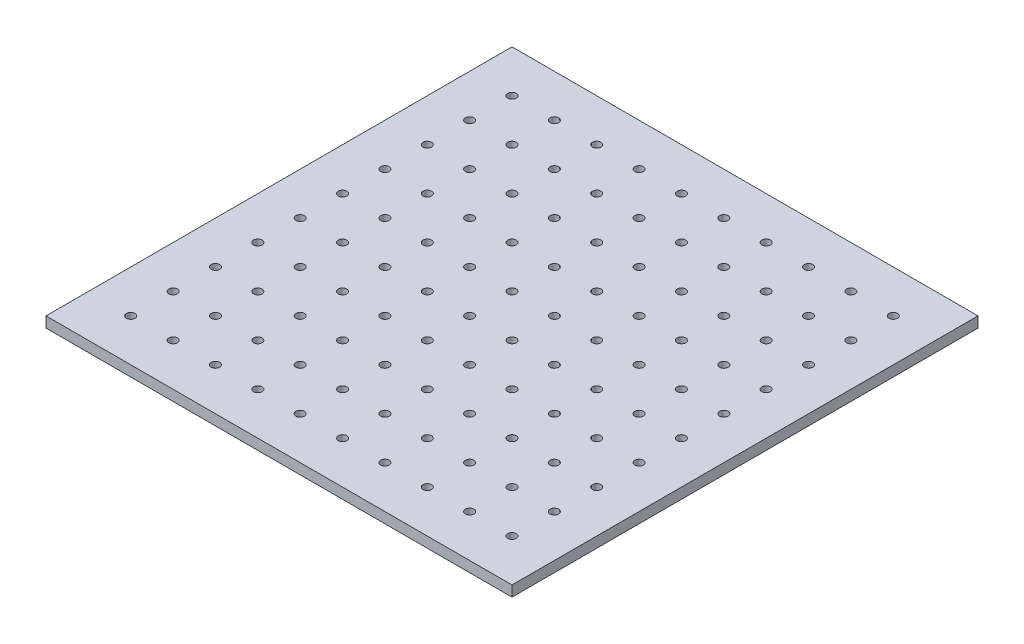
from build123d import *

# Parameters (mm, degrees)
SKETCH1_W           = 279.4
SKETCH1_H           = 279.4
SKETCH1_R           = 2.5527
BOSS_EXTRUDE1_DEPTH = 6.35


with BuildPart() as part:
    # Sketch1 → Boss-Extrude1 (new body)
    with BuildSketch(Plane(origin=(0, 0, 0), x_dir=(1, 0, 0), z_dir=(0, 1, 0))):
        with Locations((114.3, 114.3)):
            Rectangle(SKETCH1_W, SKETCH1_H)
        Circle(SKETCH1_R, mode=Mode.SUBTRACT)
        with Locations((25.4, 0)):
            Circle(SKETCH1_R, mode=Mode.SUBTRACT)
        with Locations((50.8, 0)):
            Circle(SKETCH1_R, mode=Mode.SUBTRACT)
        with Locations((76.2, 0)):
            Circle(SKETCH1_R, mode=Mode.SUBTRACT)
        with Locations((101.6, 0)):
            Circle(SKETCH1_R, mode=Mode.SUBTRACT)
        with Locations((127, 0)):
            Circle(SKETCH1_R, mode=Mode.SUBTRACT)
        with Locations((152.4, 0)):
            Circle(SKETCH1_R, mode=Mode.SUBTRACT)
        with Locations((177.8, 0)):
            Circle(SKETCH1_R, mode=Mode.SUBTRACT)
        with Locations((203.2, 0)):
            Circle(SKETCH1_R, mode=Mode.SUBTRACT)
        with Locations((228.6, 0)):
            Circle(SKETCH1_R, mode=Mode.SUBTRACT)
        with Locations((0, 25.4)):
            Circle(SKETCH1_R, mode=Mode.SUBTRACT)
        with Locations((25.4, 25.4)):
            Circle(SKETCH1_R, mode=Mode.SUBTRACT)
        with Locations((50.8, 25.4)):
            Circle(SKETCH1_R, mode=Mode.SUBTRACT)
        with Locations((76.2, 25.4)):
            Circle(SKETCH1_R, mode=Mode.SUBTRACT)
        with Locations((101.6, 25.4)):
            Circle(SKETCH1_R, mode=Mode.SUBTRACT)
        with Locations((127, 25.4)):
            Circle(SKETCH1_R, mode=Mode.SUBTRACT)
        with Locations((152.4, 25.4)):
            Circle(SKETCH1_R, mode=Mode.SUBTRACT)
        with Locations((177.8, 25.4)):
            Circle(SKETCH1_R, mode=Mode.SUBTRACT)
        with Locations((203.2, 25.4)):
            Circle(SKETCH1_R, mode=Mode.SUBTRACT)
        with Locations((228.6, 25.4)):
            Circle(SKETCH1_R, mode=Mode.SUBTRACT)
        with Locations((0, 50.8)):
            Circle(SKETCH1_R, mode=Mode.SUBTRACT)
        with Locations((25.4, 50.8)):
            Circle(SKETCH1_R, mode=Mode.SUBTRACT)
        with Locations((50.8, 50.8)):
            Circle(SKETCH1_R, mode=Mode.SUBTRACT)
        with Locations((76.2, 50.8)):
            Circle(SKETCH1_R, mode=Mode.SUBTRACT)
        with Locations((101.6, 50.8)):
            Circle(SKETCH1_R, mode=Mode.SUBTRACT)
        with Locations((127, 50.8)):
            Circle(SKETCH1_R, mode=Mode.SUBTRACT)
        with Locations((152.4, 50.8)):
            Circle(SKETCH1_R, mode=Mode.SUBTRACT)
        with Locations((177.8, 50.8)):
            Circle(SKETCH1_R, mode=Mode.SUBTRACT)
        with Locations((203.2, 50.8)):
            Circle(SKETCH1_R, mode=Mode.SUBTRACT)
        with Locations((228.6, 50.8)):
            Circle(SKETCH1_R, mode=Mode.SUBTRACT)
        with Locations((0, 76.2)):
            Circle(SKETCH1_R, mode=Mode.SUBTRACT)
        with Locations((25.4, 76.2)):
            Circle(SKETCH1_R, mode=Mode.SUBTRACT)
        with Locations((50.8, 76.2)):
            Circle(SKETCH1_R, mode=Mode.SUBTRACT)
        with Locations((76.2, 76.2)):
            Circle(SKETCH1_R, mode=Mode.SUBTRACT)
        with Locations((101.6, 76.2)):
            Circle(SKETCH1_R, mode=Mode.SUBTRACT)
        with Locations((127, 76.2)):
            Circle(SKETCH1_R, mode=Mode.SUBTRACT)
        with Locations((152.4, 76.2)):
            Circle(SKETCH1_R, mode=Mode.SUBTRACT)
        with Locations((177.8, 76.2)):
            Circle(SKETCH1_R, mode=Mode.SUBTRACT)
        with Locations((203.2, 76.2)):
            Circle(SKETCH1_R, mode=Mode.SUBTRACT)
        with Locations((228.6, 76.2)):
            Circle(SKETCH1_R, mode=Mode.SUBTRACT)
        with Locations((0, 101.6)):
            Circle(SKETCH1_R, mode=Mode.SUBTRACT)
        with Locations((25.4, 101.6)):
            Circle(SKETCH1_R, mode=Mode.SUBTRACT)
        with Locations((50.8, 101.6)):
            Circle(SKETCH1_R, mode=Mode.SUBTRACT)
        with Locations((76.2, 101.6)):
            Circle(SKETCH1_R, mode=Mode.SUBTRACT)
        with Locations((101.6, 101.6)):
            Circle(SKETCH1_R, mode=Mode.SUBTRACT)
        with Locations((127, 101.6)):
            Circle(SKETCH1_R, mode=Mode.SUBTRACT)
        with Locations((152.4, 101.6)):
            Circle(SKETCH1_R, mode=Mode.SUBTRACT)
        with Locations((177.8, 101.6)):
            Circle(SKETCH1_R, mode=Mode.SUBTRACT)
        with Locations((203.2, 101.6)):
            Circle(SKETCH1_R, mode=Mode.SUBTRACT)
        with Locations((228.6, 101.6)):
            Circle(SKETCH1_R, mode=Mode.SUBTRACT)
        with Locations((0, 127)):
            Circle(SKETCH1_R, mode=Mode.SUBTRACT)
        with Locations((25.4, 127)):
            Circle(SKETCH1_R, mode=Mode.SUBTRACT)
        with Locations((50.8, 127)):
            Circle(SKETCH1_R, mode=Mode.SUBTRACT)
        with Locations((76.2, 127)):
            Circle(SKETCH1_R, mode=Mode.SUBTRACT)
        with Locations((101.6, 127)):
            Circle(SKETCH1_R, mode=Mode.SUBTRACT)
        with Locations((127, 127)):
            Circle(SKETCH1_R, mode=Mode.SUBTRACT)
        with Locations((152.4, 127)):
            Circle(SKETCH1_R, mode=Mode.SUBTRACT)
        with Locations((177.8, 127)):
            Circle(SKETCH1_R, mode=Mode.SUBTRACT)
        with Locations((203.2, 127)):
            Circle(SKETCH1_R, mode=Mode.SUBTRACT)
        with Locations((228.6, 127)):
            Circle(SKETCH1_R, mode=Mode.SUBTRACT)
        with Locations((0, 152.4)):
            Circle(SKETCH1_R, mode=Mode.SUBTRACT)
        with Locations((25.4, 152.4)):
            Circle(SKETCH1_R, mode=Mode.SUBTRACT)
        with Locations((50.8, 152.4)):
            Circle(SKETCH1_R, mode=Mode.SUBTRACT)
        with Locations((76.2, 152.4)):
            Circle(SKETCH1_R, mode=Mode.SUBTRACT)
        with Locations((101.6, 152.4)):
            Circle(SKETCH1_R, mode=Mode.SUBTRACT)
        with Locations((127, 152.4)):
            Circle(SKETCH1_R, mode=Mode.SUBTRACT)
        with Locations((152.4, 152.4)):
            Circle(SKETCH1_R, mode=Mode.SUBTRACT)
        with Locations((177.8, 152.4)):
            Circle(SKETCH1_R, mode=Mode.SUBTRACT)
        with Locations((203.2, 152.4)):
            Circle(SKETCH1_R, mode=Mode.SUBTRACT)
        with Locations((228.6, 152.4)):
            Circle(SKETCH1_R, mode=Mode.SUBTRACT)
        with Locations((0, 177.8)):
            Circle(SKETCH1_R, mode=Mode.SUBTRACT)
        with Locations((25.4, 177.8)):
            Circle(SKETCH1_R, mode=Mode.SUBTRACT)
        with Locations((50.8, 177.8)):
            Circle(SKETCH1_R, mode=Mode.SUBTRACT)
        with Locations((76.2, 177.8)):
            Circle(SKETCH1_R, mode=Mode.SUBTRACT)
        with Locations((101.6, 177.8)):
            Circle(SKETCH1_R, mode=Mode.SUBTRACT)
        with Locations((127, 177.8)):
            Circle(SKETCH1_R, mode=Mode.SUBTRACT)
        with Locations((152.4, 177.8)):
            Circle(SKETCH1_R, mode=Mode.SUBTRACT)
        with Locations((177.8, 177.8)):
            Circle(SKETCH1_R, mode=Mode.SUBTRACT)
        with Locations((203.2, 177.8)):
            Circle(SKETCH1_R, mode=Mode.SUBTRACT)
        with Locations((228.6, 177.8)):
            Circle(SKETCH1_R, mode=Mode.SUBTRACT)
        with Locations((0, 203.2)):
            Circle(SKETCH1_R, mode=Mode.SUBTRACT)
        with Locations((25.4, 203.2)):
            Circle(SKETCH1_R, mode=Mode.SUBTRACT)
        with Locations((50.8, 203.2)):
            Circle(SKETCH1_R, mode=Mode.SUBTRACT)
        with Locations((76.2, 203.2)):
            Circle(SKETCH1_R, mode=Mode.SUBTRACT)
        with Locations((101.6, 203.2)):
            Circle(SKETCH1_R, mode=Mode.SUBTRACT)
        with Locations((127, 203.2)):
            Circle(SKETCH1_R, mode=Mode.SUBTRACT)
        with Locations((152.4, 203.2)):
            Circle(SKETCH1_R, mode=Mode.SUBTRACT)
        with Locations((177.8, 203.2)):
            Circle(SKETCH1_R, mode=Mode.SUBTRACT)
        with Locations((203.2, 203.2)):
            Circle(SKETCH1_R, mode=Mode.SUBTRACT)
        with Locations((228.6, 203.2)):
            Circle(SKETCH1_R, mode=Mode.SUBTRACT)
        with Locations((0, 228.6)):
            Circle(SKETCH1_R, mode=Mode.SUBTRACT)
        with Locations((25.4, 228.6)):
            Circle(SKETCH1_R, mode=Mode.SUBTRACT)
        with Locations((50.8, 228.6)):
            Circle(SKETCH1_R, mode=Mode.SUBTRACT)
        with Locations((76.2, 228.6)):
            Circle(SKETCH1_R, mode=Mode.SUBTRACT)
        with Locations((101.6, 228.6)):
            Circle(SKETCH1_R, mode=Mode.SUBTRACT)
        with Locations((127, 228.6)):
            Circle(SKETCH1_R, mode=Mode.SUBTRACT)
        with Locations((152.4, 228.6)):
            Circle(SKETCH1_R, mode=Mode.SUBTRACT)
        with Locations((177.8, 228.6)):
            Circle(SKETCH1_R, mode=Mode.SUBTRACT)
        with Locations((203.2, 228.6)):
            Circle(SKETCH1_R, mode=Mode.SUBTRACT)
        with Locations((228.6, 228.6)):
            Circle(SKETCH1_R, mode=Mode.SUBTRACT)
    extrude(amount=BOSS_EXTRUDE1_DEPTH)


solid = part.part
